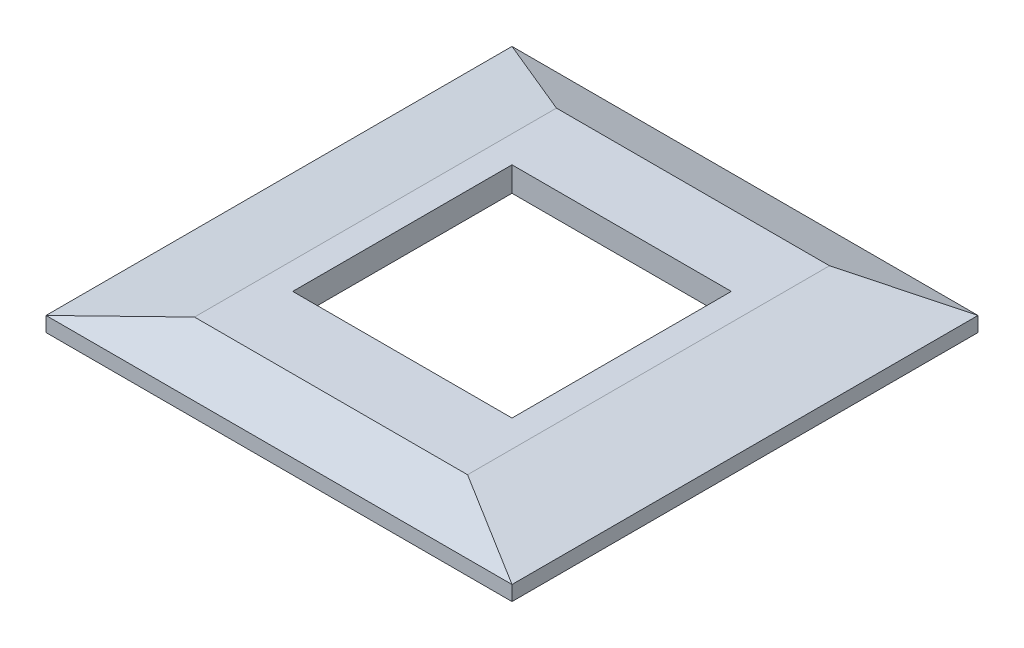
from build123d import *

# Parameters (mm, degrees)
EXTRUDE_1_DEPTH     = 42.5
SKETCH_2_OUTSIDE_W  = 111.076
SKETCH_2_OUTSIDE_H  = 32.576
CUT_EXTRUDE_1_DEPTH = 96.254921133
SKETCH_3_W          = 40
SKETCH_3_H          = 40
CUT_EXTRUDE_2_DEPTH = 96.254921133
SKETCH_4_W          = 81.5
SKETCH_4_H          = 81
CUT_EXTRUDE_3_DEPTH = 2


with BuildPart() as part:
    # Эскиз1 → Бобышка-Вытянуть1 (new, symmetric)
    with BuildSketch(Plane.XY):
        Polygon((0, 0), (-85, 0), (-85, 2.705180544), (-67.404564646, 6.5), (-17.595435354, 6.5), (0, 2.705180544), align=None)
    extrude(amount=EXTRUDE_1_DEPTH, both=True)

    # Эскиз2 outside → Вырез-Вытянуть1 (cut, through all)
    with BuildSketch(Plane(origin=(0, 0, 0), x_dir=(0, 0, -1), z_dir=(1, 0, 0))):
        with Locations((0, 3.25)):
            Rectangle(SKETCH_2_OUTSIDE_W, SKETCH_2_OUTSIDE_H)
        Polygon((-42.5, 2.705180544), (-42.5, 0), (42.5, 0), (42.5, 2.705180544), (33.00957815, 6.5), (-33.00957815, 6.5), align=None, mode=Mode.SUBTRACT)
    extrude(amount=-CUT_EXTRUDE_1_DEPTH, mode=Mode.SUBTRACT)

    # Эскиз3 → Вырез-Вытянуть2 (cut, through all)
    with BuildSketch(Plane.XZ):
        with Locations((-42.5, 0)):
            Rectangle(SKETCH_3_W, SKETCH_3_H)
    extrude(amount=-CUT_EXTRUDE_2_DEPTH, mode=Mode.SUBTRACT)

    # Эскиз4 → Вырез-Вытянуть3 (cut)
    with BuildSketch(Plane.XZ):
        with Locations((-42.75, 0)):
            Rectangle(SKETCH_4_W, SKETCH_4_H)
    extrude(amount=-CUT_EXTRUDE_3_DEPTH, mode=Mode.SUBTRACT)


solid = part.part
